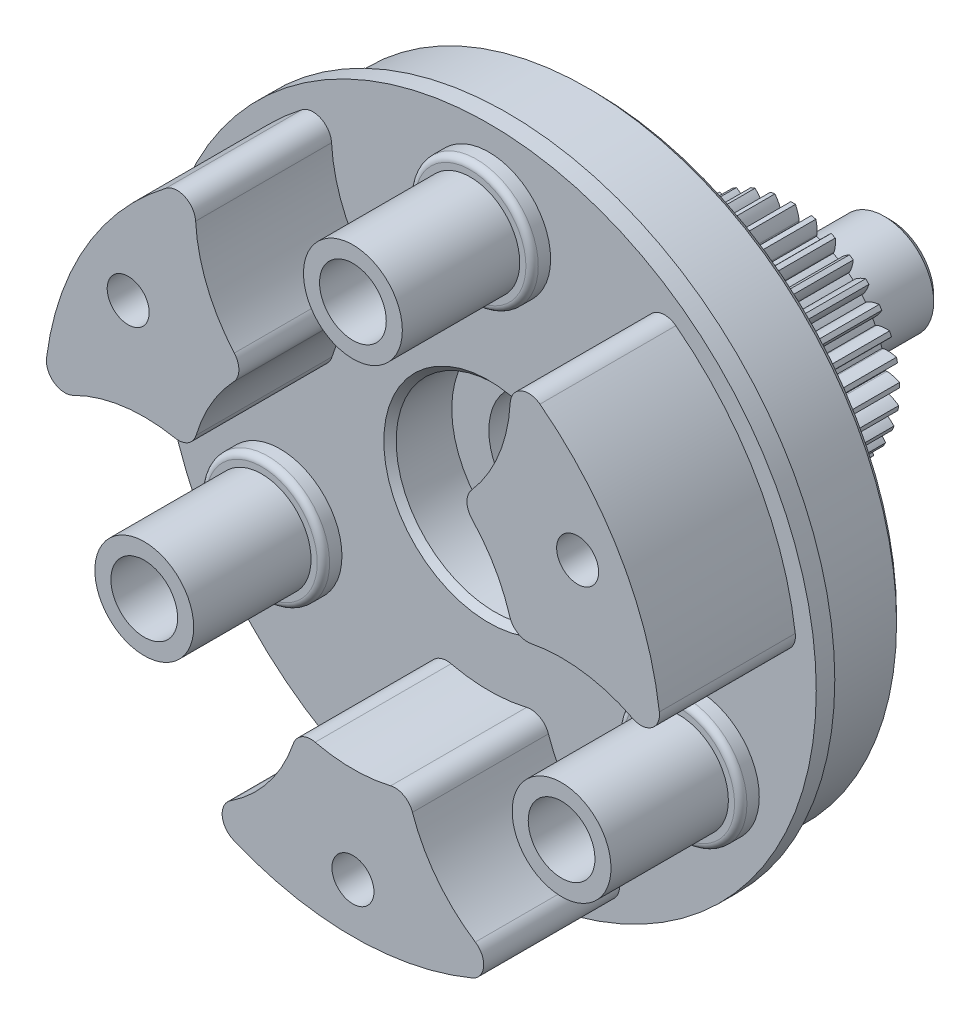
from build123d import *

# Parameters (mm, degrees)
SKETCH1_R           = 25
SKETCH1_R_2         = 2.7
SKETCH1_R_3         = 2.700000000000001
BOSS_EXTRUDE1_DEPTH = 8.5
SKETCH2_R           = 4.0000000000000036
SKETCH2_R_2         = 2.7
BOSS_EXTRUDE2_DEPTH = 11
SKETCH3_R           = 5.0000000000000036
SKETCH3_R_2         = 4.0000000000000036
BOSS_EXTRUDE3_DEPTH = 1.5
BOSS_EXTRUDE4_DEPTH = 11
FILLET2_R           = 0.5
FILLET5_R           = 1.5
CIRPATTERN1_START   = 8.5
CIRPATTERN1_DEPTH   = 11
SKETCH5_R           = 1.7000000000000004
CUT_EXTRUDE1_DEPTH  = 41.37635463857529
SKETCH6_R           = 2.9500000000000006
CUT_EXTRUDE2_DEPTH  = 3
SKETCH7_R           = 4.45
CUT_EXTRUDE3_DEPTH  = 5
CIRPATTERN2_COUNT   = 3
CHAMFER1_SIZE       = 0.5
SKETCH9_R           = 8
CUT_EXTRUDE4_DEPTH  = 38.02701732789181
BOSS_EXTRUDE7_START = -3.5
SKETCH10_R          = 8
SKETCH10_R_2        = 5
BOSS_EXTRUDE7_DEPTH = 3.5
CHAMFER2_SIZE       = 0.5
BOSS_EXTRUDE8_START = -1.5
SKETCH11_R          = 26.500000000000004
SKETCH11_R_2        = 25
BOSS_EXTRUDE8_DEPTH = 1.5
SKETCH14_R          = 8.750000000000002
BOSS_EXTRUDE9_DEPTH = 16
CUT_EXTRUDE7_START  = -16
CUT_EXTRUDE7_DEPTH  = 16
CIRPATTERN4_COUNT   = 33
SKETCH19_R          = 2.5
CUT_EXTRUDE8_DEPTH  = 43.24630178489001
SKETCH20_R          = 4.45
CUT_EXTRUDE9_DEPTH  = 6
SKETCH19_2_R        = 2.5
CUT_EXTRUDE10_DEPTH = 45.50280901920687
CHAMFER3_SIZE       = 0.5
CHAMFER4_SIZE       = 0.75


# Read off the part's stored shape, not the designer's step: CirPattern1
with BuildPart() as part:
    # Sketch1 → Boss-Extrude1 (new body)
    with BuildSketch(Plane.XY):
        Circle(SKETCH1_R)
        with Locations((0, 19.5)):
            Circle(SKETCH1_R_2, mode=Mode.SUBTRACT)
        with Locations((16.88749537379534, -9.750000000002109)):
            Circle(SKETCH1_R_3, mode=Mode.SUBTRACT)
        with Locations((-16.887495373799002, -9.750000000000005)):
            Circle(SKETCH1_R_3, mode=Mode.SUBTRACT)
    extrude(amount=BOSS_EXTRUDE1_DEPTH)

    # Sketch2 → Boss-Extrude2 (add)
    with BuildSketch(Plane.XY.offset(8.5)):
        with Locations((0, 19.5)):
            Circle(SKETCH2_R)
        with Locations((0, 19.5)):
            Circle(SKETCH2_R_2, mode=Mode.SUBTRACT)
    extrude(amount=BOSS_EXTRUDE2_DEPTH)

    # Sketch3 → Boss-Extrude3 (add)
    with BuildSketch(Plane.XY.offset(8.5)):
        with Locations((0, 19.5)):
            Circle(SKETCH3_R)
        with Locations((0, 19.5)):
            Circle(SKETCH3_R_2, mode=Mode.SUBTRACT)
    extrude(amount=BOSS_EXTRUDE3_DEPTH)

    # Sketch4 → Boss-Extrude4 (add)
    with BuildSketch(Plane.XY.offset(8.5)):
        with BuildLine():
            ThreePointArc((-8.595864638818421, 10.083333333333332), (-12.051904233708413, 15.338977969113694), (-12.57463654020182, 21.6073717948718))
            ThreePointArc((-12.57463654020182, 21.607371794871796), (-21.650635094611, 12.499999999999941), (-24.999851153475248, 0.08626878973480237))
            ThreePointArc((-24.999851153475245, 0.08626878973480423), (-19.309896706196515, 2.7677662458117602), (-13.030355140902314, 2.402570478042364))
            ThreePointArc((-13.030355140902312, 2.402570478042366), (-11.474836600143831, 6.62499999999997), (-8.595864638818423, 10.08333333333333))
        make_face()
    extrude(amount=BOSS_EXTRUDE4_DEPTH)

    # Fillet2
    fillet2_edges = [part.edges().sort_by_distance(p)[0] for p in [
        (-5.0000000000000036, 19.5, 10),
    ]]
    fillet(fillet2_edges, radius=FILLET2_R)

    # Fillet5
    fillet5_edges = [part.edges().sort_by_distance(p)[0] for p in [
        (-12.57463654020182, 21.607371794871796, 14),
        (-24.999851153475248, 0.08626878973480534, 14),
        (-13.030355140902312, 2.4025704780423656, 14),
        (-8.59586463881842, 10.083333333333332, 14),
    ]]
    fillet(fillet5_edges, radius=FILLET5_R)

    # CirPattern1 outline → CirPattern1 (add)
    with BuildSketch(Plane.XY.offset(CIRPATTERN1_START)):
        with BuildLine():
            ThreePointArc((-3.055336686, -12.892921226), (-4.126430807, -13.039456894), (-4.820831386, -13.868023823))
            ThreePointArc((-4.820831386, -13.868023823), (-6.81569801, -17.568017515), (-9.905301006, -20.418245489))
            ThreePointArc((-9.905301006, -20.418245489), (-10.577616507, -21.810119667), (-9.663687632, -23.056737439))
            ThreePointArc((-9.663687632, -23.056737439), (0, -25), (9.663687632, -23.056737439))
            ThreePointArc((9.663687632, -23.056737439), (10.577616507, -21.810119667), (9.905301006, -20.418245489))
            ThreePointArc((9.905301006, -20.418245489), (6.81569801, -17.568017515), (4.820831386, -13.868023823))
            ThreePointArc((4.820831386, -13.868023823), (4.126430807, -13.039456894), (3.055336686, -12.892921226))
            ThreePointArc((3.055336686, -12.892921226), (0, -13.25), (-3.055336686, -12.892921226))
        make_face()
        with BuildLine():
            ThreePointArc((24.799564167, 3.159369736), (21.650635095, 12.5), (15.135876535, 19.897367703))
            ThreePointArc((15.135876535, 19.897367703), (13.599309437, 20.06554444), (12.730068791, 18.787365047))
            ThreePointArc((12.730068791, 18.787365047), (11.806500457, 14.686576379), (9.599645238, 11.108974359))
            ThreePointArc((9.599645238, 11.108974359), (9.229285518, 10.093322353), (9.637928968, 9.0924598))
            ThreePointArc((9.637928968, 9.0924598), (11.4748366, 6.625), (12.693265654, 3.800461426))
            ThreePointArc((12.693265654, 3.800461426), (13.355716326, 2.946134541), (14.420476624, 2.759049464))
            ThreePointArc((14.420476624, 2.759049464), (18.622198468, 2.881441136), (22.635369797, 1.630880441))
            ThreePointArc((22.635369797, 1.630880441), (24.176925945, 1.744575226), (24.799564167, 3.159369736))
        make_face()
    extrude(amount=CIRPATTERN1_DEPTH)

    # CirPattern1 2 outline → CirPattern1 2 (revolve)
    with BuildSketch(Plane(origin=(-16.887495374, -9.75, 0), x_dir=(1, 0, 0), z_dir=(0, -1, 0))):
        with BuildLine():
            Line((4, 19.5), (2.7, 19.5))
            Line((2.7, 19.5), (2.7, 8.5))
            Line((2.7, 8.5), (5, 8.5))
            Line((5, 8.5), (5, 9.5))
            ThreePointArc((5, 9.5), (4.853553391, 9.853553391), (4.5, 10))
            Line((4.5, 10), (4, 10))
            Line((4, 10), (4, 19.5))
        make_face()
    revolve(axis=Axis((-16.887495374, -9.75, 0), (0, 0, 1)))

    # CirPattern1 3 outline → CirPattern1 3 (revolve)
    with BuildSketch(Plane(origin=(16.887495374, -9.75, 0), x_dir=(1, 0, 0), z_dir=(0, -1, 0))):
        with BuildLine():
            Line((4, 19.5), (2.7, 19.5))
            Line((2.7, 19.5), (2.7, 8.5))
            Line((2.7, 8.5), (5, 8.5))
            Line((5, 8.5), (5, 9.5))
            ThreePointArc((5, 9.5), (4.853553391, 9.853553391), (4.5, 10))
            Line((4.5, 10), (4, 10))
            Line((4, 10), (4, 19.5))
        make_face()
    revolve(axis=Axis((16.887495374, -9.75, 0), (0, 0, 1)))

    # Sketch5 → Cut-Extrude1 (cut, through all)
    with BuildSketch(Plane.XY.offset(19.5)):
        with Locations((-18.186533479473244, 10.499999999999954)):
            Circle(SKETCH5_R)
    cut_extrude1 = extrude(amount=-CUT_EXTRUDE1_DEPTH, mode=Mode.SUBTRACT)

    # Sketch6 → Cut-Extrude2 (cut)
    with BuildSketch(Plane(origin=(0, 0, 0), x_dir=(-1, 0, 0), z_dir=(0, 0, -1))):
        with Locations((18.186533479473244, 10.499999999999957)):
            Circle(SKETCH6_R)
    cut_extrude2 = extrude(amount=-CUT_EXTRUDE2_DEPTH, mode=Mode.SUBTRACT)

    # Sketch7 → Cut-Extrude3 (cut)
    with BuildSketch(Plane(origin=(0, 0, 0), x_dir=(-1, 0, 0), z_dir=(0, 0, -1))):
        with Locations((0, 19.5)):
            Circle(SKETCH7_R)
    cut_extrude3 = extrude(amount=-CUT_EXTRUDE3_DEPTH, mode=Mode.SUBTRACT)

    # CirPattern2: Cut-Extrude1, Cut-Extrude2, Cut-Extrude3 ×3 about axis
    cirpattern2_axis = Axis((4.8e-16, -1.84e-15, 0), (0, 0, 1))
    add([cut_extrude1.rotate(cirpattern2_axis, i * 360 / CIRPATTERN2_COUNT) for i in range(1, CIRPATTERN2_COUNT)], mode=Mode.SUBTRACT)
    add([cut_extrude2.rotate(cirpattern2_axis, i * 360 / CIRPATTERN2_COUNT) for i in range(1, CIRPATTERN2_COUNT)], mode=Mode.SUBTRACT)
    add([cut_extrude3.rotate(cirpattern2_axis, i * 360 / CIRPATTERN2_COUNT) for i in range(1, CIRPATTERN2_COUNT)], mode=Mode.SUBTRACT)

    # Chamfer1
    chamfer1_edges = [part.edges().sort_by_distance(p)[0] for p in [
        (-25, 3.06e-15, 0),
    ]]
    chamfer(chamfer1_edges, length=CHAMFER1_SIZE)

    # Sketch9 → Cut-Extrude4 (cut, through all)
    with BuildSketch(Plane.XY.offset(8.5)):
        Circle(SKETCH9_R)
    extrude(amount=-CUT_EXTRUDE4_DEPTH, mode=Mode.SUBTRACT)

    # Sketch10 → Boss-Extrude7 (add)
    with BuildSketch(Plane(origin=(0, 0, 0), x_dir=(-1, 0, 0), z_dir=(0, 0, -1)).offset(BOSS_EXTRUDE7_START)):
        with Locations(Location((0, 0, 0), (0, 0, 180))):
            Circle(SKETCH10_R)
        Circle(SKETCH10_R_2, mode=Mode.SUBTRACT)
    extrude(amount=BOSS_EXTRUDE7_DEPTH)

    # Chamfer2
    chamfer2_edges = [part.edges().sort_by_distance(p)[0] for p in [
        (-8, 9.8e-16, 8.5),
    ]]
    chamfer(chamfer2_edges, length=CHAMFER2_SIZE)

    # Sketch11 → Boss-Extrude8 (add)
    with BuildSketch(Plane.XY.offset(8.5).offset(BOSS_EXTRUDE8_START)):
        Circle(SKETCH11_R)
        Circle(SKETCH11_R_2, mode=Mode.SUBTRACT)
    extrude(amount=BOSS_EXTRUDE8_DEPTH)

    # Sketch14 → Boss-Extrude9 (add)
    with BuildSketch(Plane(origin=(0, 0, 0), x_dir=(-1, 0, 0), z_dir=(0, 0, -1))):
        with Locations(Location((0, 0, 0), (0, 0, 180))):
            Circle(SKETCH14_R)
    extrude(amount=BOSS_EXTRUDE9_DEPTH)

    # Sketch18 → Cut-Extrude7 (cut)
    with BuildSketch(Plane(origin=(0, 0, -16), x_dir=(-1, 0, 0), z_dir=(0, 0, -1)).offset(CUT_EXTRUDE7_START)):
        with BuildLine():
            add(Edge.make_bspline(
                [(7.752464120000002, 0), (7.755114329808437, 3.812818361113e-05), (7.762545642435013, 0.00026314250976963), (7.78548045504723, 0.00171973618726822), (7.830623354760358, 0.00673529641515032), (7.886132560325082, 0.01599645015694328), (7.949655278591532, 0.02956698183570081), (8.010654672002246, 0.04495687635611725), (8.062597599941261, 0.05953276941637385), (8.114195285675441, 0.07538775532422771), (8.16538438097621, 0.09236498129487782), (8.227119529761556, 0.11432205084138299), (8.300754212584286, 0.14258292413304705), (8.386191509758866, 0.1784126127267129), (8.482300870371411, 0.22233698634814536), (8.579326465972025, 0.2705888034174373), (8.655734846712296, 0.31120785331611517), (8.70847078999913, 0.3408027718884835), (8.737244590689771, 0.3573387997885168), (8.742574056600576, 0.3604148510445804)],
                knots=[0, 0, 0, 0, 0, 0.00537674862614465, 0.01508368816988081, 0.0466101395524024, 0.09211052548720021, 0.11947617586779118, 0.14684249576846414, 0.1742088538870795, 0.20157495562950026, 0.22894101319225135, 0.2563073451901873, 0.30703503216496025, 0.36176735177073854, 0.4164996607178738, 0.4712319366918086, 0.5259642819310841, 0.5384371617199206, 0.5384371617199206, 0.5384371617199206, 0.5384371617199206, 0.5384371617199206], degree=4))
            Line((7.75246412, 0), (7.625, 0))
            ThreePointArc((7.625, -1.87e-15), (7.620924815664994, -0.24925880923547292), (7.608703618627807, -0.4982511855280565))
            Line((7.608703618627809, -0.4982511855280568), (7.735895318442785, -0.5065802542365526))
            add(Edge.make_bspline(
                [(7.735895318442783, -0.5065802542365526), (7.738537372678443, -0.5067914773483646), (7.745938099448033, -0.507501605563957), (7.768728714817097, -0.5104537481421619), (7.8134473948920995, -0.5184084254609121), (7.868232799799226, -0.5312770027026509), (7.930732996893144, -0.5489693860698699), (7.990596376852401, -0.568312358687734), (8.041475837544045, -0.5862512800907146), (8.091927212315658, -0.6054440009743742), (8.141897537782189, -0.6257298643313466), (8.202065972408729, -0.6516740539161269), (8.273696590641904, -0.6846861426888906), (8.356610018492347, -0.7260221054249488), (8.449643758642589, -0.7761328127541228), (8.54330900130329, -0.8306215856295247), (8.616899851567512, -0.8761466844147898), (8.66758922327298, -0.909124351339009), (8.695220990608272, -0.9275052451917334), (8.70033806344446, -0.9309229730647114)],
                knots=[0, 0, 0, 0, 0, 0.00537674862614472, 0.01508368816988009, 0.04661013955240188, 0.09211052548720006, 0.11947617586779155, 0.14684249576846417, 0.17420885388707974, 0.20157495562950203, 0.22894101319225238, 0.25630734519018916, 0.3070350321649607, 0.3617673517707406, 0.41649966071787475, 0.4712319366918112, 0.5259642819310867, 0.5384371617199597, 0.5384371617199597, 0.5384371617199597, 0.5384371617199597, 0.5384371617199597], degree=4))
            ThreePointArc((8.700338063444454, -0.9309229730647128), (8.737575695098126, -0.46612334465302235), (8.750000000000002, -2.14e-15))
            ThreePointArc((8.750000000000002, 0), (8.748143317163239, 0.18024567227040725), (8.742574056600638, 0.36041485104456183))
        make_face()
    cut_extrude7 = extrude(amount=CUT_EXTRUDE7_DEPTH, mode=Mode.SUBTRACT)

    # CirPattern4: Cut-Extrude7 ×33 about axis
    cirpattern4_axis = Axis((0, 0, -16), (0, 0, 1))
    for i in range(1, CIRPATTERN4_COUNT):
        add(cut_extrude7.rotate(cirpattern4_axis, i * 360 / CIRPATTERN4_COUNT), mode=Mode.SUBTRACT)

    # Sketch19 → Cut-Extrude8 (cut, through all)
    with BuildSketch(Plane.XY):
        Circle(SKETCH19_R)
    extrude(amount=-CUT_EXTRUDE8_DEPTH, mode=Mode.SUBTRACT)

    # Sketch20 → Cut-Extrude9 (cut)
    with BuildSketch(Plane.XY):
        Circle(SKETCH20_R)
    extrude(amount=-CUT_EXTRUDE9_DEPTH, mode=Mode.SUBTRACT)

    # Sketch22 → Revolve1 (revolve)
    with BuildSketch(Plane(origin=(0, 0, 0), x_dir=(1, 0, 0), z_dir=(0, 1, 0))):
        Polygon((0, 24), (4, 24), (4.000000000000001, 17.5), (4.500000000000001, 17.5), (4.500000000000001, 16), (8.7e-16, 16), align=None)
    revolve(axis=Axis((0, 0, 0), (0, 0, -1)))

    # Sketch19<2> → Cut-Extrude10 (cut, through all)
    with BuildSketch(Plane.XY):
        Circle(SKETCH19_2_R)
    extrude(amount=-CUT_EXTRUDE10_DEPTH, mode=Mode.SUBTRACT)

    # Chamfer3
    chamfer3_edges = [part.edges().sort_by_distance(p)[0] for p in [
        (-4, -4.9e-16, -24),
    ]]
    chamfer(chamfer3_edges, length=CHAMFER3_SIZE)

    # Chamfer4
    chamfer4_edges = [part.edges().sort_by_distance(p)[0] for p in [
        (-4.500000000000001, -5.5e-16, -16),
    ]]
    chamfer(chamfer4_edges, length=CHAMFER4_SIZE)


solid = part.part
